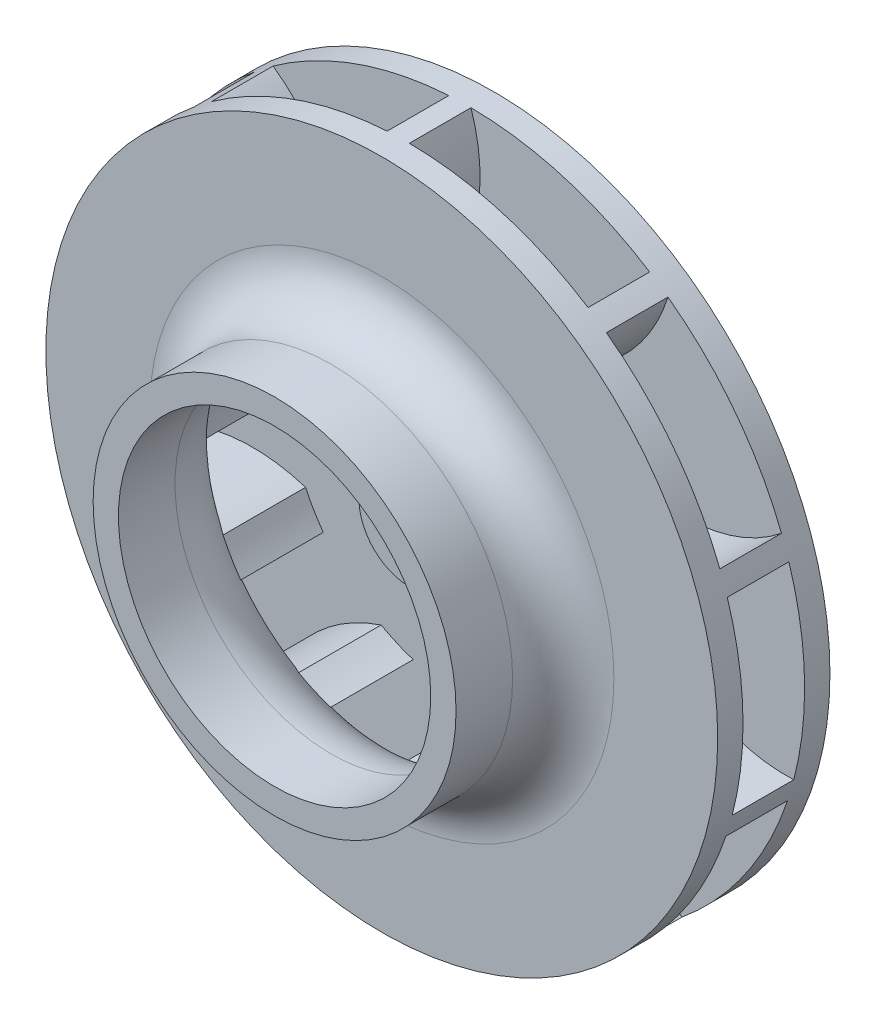
from build123d import *

# Parameters (mm, degrees)
SKETCH1_R                  = 39.8
BODY_DEPTH                 = 3
SKETCH2_R                  = 6
SPIGOT_DEPTH               = 7
FILLET_2_R                 = 7
M6_TAPPED_HOLE_D           = 5
M6_TAPPED_HOLE_CSINK_D     = 6.05
M6_TAPPED_HOLE_CSINK_ANGLE = 90
BLADE_DEPTH                = 10
CIRPATTERN1_COUNT          = 10


with BuildPart() as part:
    # Sketch1 → Body (new body)
    with BuildSketch(Plane.XY):
        Circle(SKETCH1_R)
    extrude(amount=BODY_DEPTH)

    # Sketch2 → Spigot (add)
    with BuildSketch(Plane.XY.offset(3)):
        Circle(SKETCH2_R)
    extrude(amount=SPIGOT_DEPTH)

    # Fillet 2
    fillet_2_edges = [part.edges().sort_by_distance(p)[0] for p in [
        (-6, 0, 3),
    ]]
    fillet(fillet_2_edges, radius=FILLET_2_R - 0.0001)  # a hair under: the kernel refuses the full size

    # M6 Tapped Hole (through all)
    with Locations(Plane.XY.offset(10)):
        with Locations((0, 0)):
            CounterSinkHole(M6_TAPPED_HOLE_D / 2, M6_TAPPED_HOLE_CSINK_D / 2, counter_sink_angle=M6_TAPPED_HOLE_CSINK_ANGLE)

    # Sketch5 → Blade (add)
    with BuildSketch(Plane.XY.offset(3)):
        with BuildLine():
            ThreePointArc((-20.897673948, 4.120342653), (-21.199179879, 2.069969192), (-21.3, 0))
            ThreePointArc((-21.3, 0), (-28.410626291, 7.584610136), (-38.515530887, 10.029650068))
            ThreePointArc((-38.515530887, 10.029650068), (-38.162770637, 11.297917389), (-37.768260267, 12.553824773))
            ThreePointArc((-37.768260267, 12.553824773), (-28.315057052, 10.373341004), (-20.897673948, 4.120342653))
        make_face()
    blade = extrude(amount=BLADE_DEPTH)

    # CirPattern1: Blade ×10 about axis
    cirpattern1_axis = Axis((0, 0, 0), (0, 0, 1))
    for i in range(1, CIRPATTERN1_COUNT):
        add(blade.rotate(cirpattern1_axis, i * 360 / CIRPATTERN1_COUNT))

    # Sketch6 → Revolve1 (revolve)
    with BuildSketch(Plane(origin=(0, 0, 0), x_dir=(0, 0, -1), z_dir=(1, 0, 0)), mode=Mode.PRIVATE) as revolve1_sk:
        with BuildLine():
            Line((-13.3, 39.8), (-13.3, 27.5))
            ThreePointArc((-13.3, 27.5), (-15.057359313, 23.257359313), (-19.3, 21.5))
            Line((-19.3, 21.5), (-26, 21.5))
            Line((-26, 21.5), (-26, 18.5))
            Line((-26, 18.5), (-19.3, 18.5))
            ThreePointArc((-19.3, 18.5), (-12.936038969, 21.136038969), (-10.3, 27.5))
            Line((-10.3, 27.5), (-10.3, 39.8))
            Line((-10.3, 39.8), (-13.3, 39.8))
        make_face()
    revolve(revolve1_sk.sketch.rotate(Axis((0, 0, 58.073822632), (0, 0, -1)), 90), axis=Axis((0, 0, 58.073822632), (0, 0, -1)))


solid = part.part
